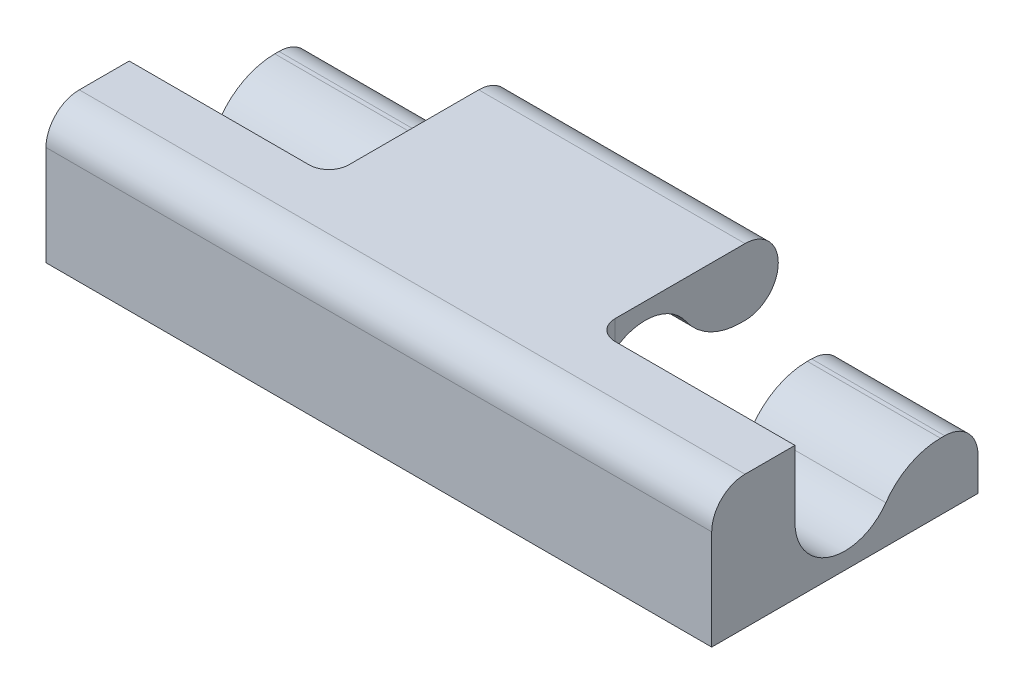
from build123d import *

# Parameters (mm, degrees)
ESQUISSE1_W             = 10
ESQUISSE1_H             = 4
BOSS_EXTRU_1_DEPTH      = 2
ESQUISSE2_R             = 0.75
ENL_V_MAT_EXTRU_1_DEPTH = 10
ESQUISSE7_W             = 2.75
ESQUISSE7_H             = 1
ENL_V_MAT_EXTRU_3_DEPTH = 3
ESQUISSE8_W             = 3
ESQUISSE8_H             = 2.75
ENL_V_MAT_EXTRU_5_DEPTH = 1
CONG_1_R                = 1
CONG_2_R                = 0.5
CONG_3_R                = 0.5
CONG_4_R                = 0.3


with BuildPart() as part:
    # Esquisse1 → Boss.-Extru.1 (new body)
    with BuildSketch(Plane(origin=(0, 0, 0), x_dir=(1, 0, 0), z_dir=(0, 1, 0))):
        Rectangle(ESQUISSE1_W, ESQUISSE1_H)
    extrude(amount=BOSS_EXTRU_1_DEPTH)

    # Esquisse2 → Enlèv. mat.-Extru.1 (cut)
    with BuildSketch(Plane(origin=(5, 0, 0), x_dir=(0, 0, -1), z_dir=(1, 0, 0))):
        with Locations((0, 1)):
            Circle(ESQUISSE2_R)
    extrude(amount=-ENL_V_MAT_EXTRU_1_DEPTH, mode=Mode.SUBTRACT)

    # Esquisse7 → Enlèv. mat.-Extru.3 (cut)
    with BuildSketch(Plane.ZY.offset(5)):
        with Locations((-0.625, 1.5)):
            Rectangle(ESQUISSE7_W, ESQUISSE7_H)
    enl_v_mat_extru_3 = extrude(amount=-ENL_V_MAT_EXTRU_3_DEPTH, mode=Mode.SUBTRACT)

    # Symétrie1: Enlèv. mat.-Extru.3 across plane
    add(enl_v_mat_extru_3.mirror(Plane.ZY), mode=Mode.SUBTRACT)

    # Esquisse8 → Enlèv. mat.-Extru.5 (cut)
    with BuildSketch(Plane.XZ):
        with Locations((-1.5, -0.625)):
            Rectangle(ESQUISSE8_W, ESQUISSE8_H)
    enl_v_mat_extru_5 = extrude(amount=-ENL_V_MAT_EXTRU_5_DEPTH, mode=Mode.SUBTRACT)

    # Symétrie3: Enlèv. mat.-Extru.5 across plane
    add(enl_v_mat_extru_5.mirror(Plane.ZY), mode=Mode.SUBTRACT)

    # Congé1
    cong_1_edges = [part.edges().sort_by_distance(p)[0] for p in [
        (-4, 1, -0.75),
        (0, 1, -0.75),
        (4, 1, -0.75),
    ]]
    fillet(cong_1_edges, radius=CONG_1_R)

    # Congé2
    cong_2_edges = [part.edges().sort_by_distance(p)[0] for p in [
        (-4, 1, -2),
        (0, 1, -2),
        (4, 1, -2),
    ]]
    fillet(cong_2_edges, radius=CONG_2_R)

    # Congé3
    cong_3_edges = [part.edges().sort_by_distance(p)[0] for p in [
        (0, 2, -2),
        (0, 2, 2),
    ]]
    fillet(cong_3_edges, radius=CONG_3_R - 0.0001)  # a hair under: the kernel refuses the full size

    # Congé4
    cong_4_edges = [part.edges().sort_by_distance(p)[0] for p in [
        (-2, 1.5, 0.75),
        (2, 1.5, 0.75),
        (-3, 0.5, 0.75),
        (3, 0.5, 0.75),
    ]]
    fillet(cong_4_edges, radius=CONG_4_R)


solid = part.part
